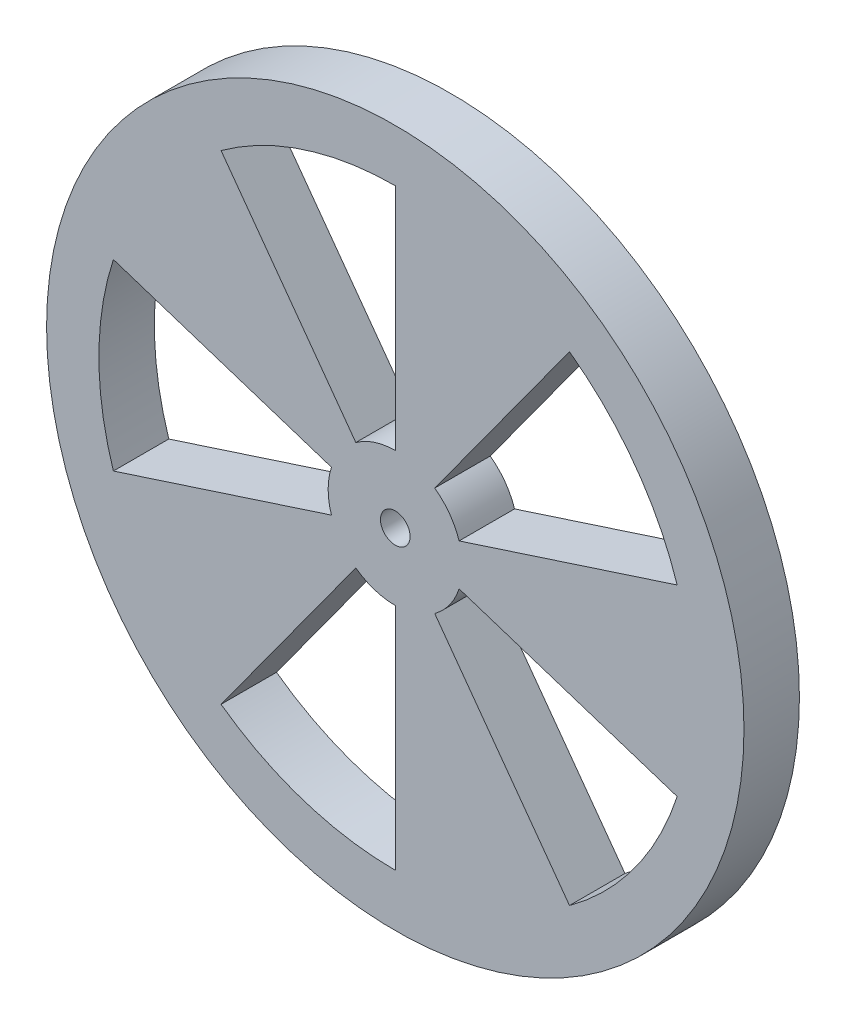
from build123d import *

# Parameters (mm, degrees)
SKETCH1_R           = 20
SKETCH1_R_2         = 0.85
BOSS_EXTRUDE1_DEPTH = 3.18
CUT_EXTRUDE1_DEPTH  = 29.46247354


with BuildPart() as part:
    # Sketch1 → Boss-Extrude1 (new body)
    with BuildSketch(Plane.XY):
        Circle(SKETCH1_R)
        Circle(SKETCH1_R_2, mode=Mode.SUBTRACT)
    extrude(amount=BOSS_EXTRUDE1_DEPTH)

    # Sketch2 → Cut-Extrude1 (cut, through all)
    with BuildSketch(Plane.XY.offset(3.18)):
        with BuildLine():
            ThreePointArc((-2.262973221, 3.114715428), (-1.189715428, 3.661567588), (0, 3.85))
            Line((0, 3.85), (0, 17))
            ThreePointArc((0, 17), (-5.253288904, 16.167960777), (-9.992349289, 13.753288904))
            Line((-9.992349289, 13.753288904), (-2.262973221, 3.114715428))
        make_face()
        with BuildLine():
            Line((9.992349289, 13.753288904), (2.262973221, 3.114715428))
            ThreePointArc((2.262973221, 3.114715428), (3.114715428, 2.262973221), (3.661567588, 1.189715428))
            Line((3.661567588, 1.189715428), (16.167960777, 5.253288904))
            ThreePointArc((16.167960777, 5.253288904), (13.753288904, 9.992349289), (9.992349289, 13.753288904))
        make_face()
        with BuildLine():
            ThreePointArc((-3.661567588, -1.189715428), (-3.85, 0), (-3.661567588, 1.189715428))
            Line((-3.661567588, 1.189715428), (-16.167960777, 5.253288904))
            ThreePointArc((-16.167960777, 5.253288904), (-17, 0), (-16.167960777, -5.253288904))
            Line((-16.167960777, -5.253288904), (-3.661567588, -1.189715428))
        make_face()
        with BuildLine():
            Line((16.167960777, -5.253288904), (3.661567588, -1.189715428))
            ThreePointArc((3.661567588, -1.189715428), (3.114715428, -2.262973221), (2.262973221, -3.114715428))
            Line((2.262973221, -3.114715428), (9.992349289, -13.753288904))
            ThreePointArc((9.992349289, -13.753288904), (13.753288904, -9.992349289), (16.167960777, -5.253288904))
        make_face()
        with BuildLine():
            ThreePointArc((0, -3.85), (-1.189715428, -3.661567588), (-2.262973221, -3.114715428))
            Line((-2.262973221, -3.114715428), (-9.992349289, -13.753288904))
            ThreePointArc((-9.992349289, -13.753288904), (-5.253288904, -16.167960777), (0, -17))
            Line((0, -17), (0, -3.85))
        make_face()
    extrude(amount=-CUT_EXTRUDE1_DEPTH, mode=Mode.SUBTRACT)


solid = part.part
